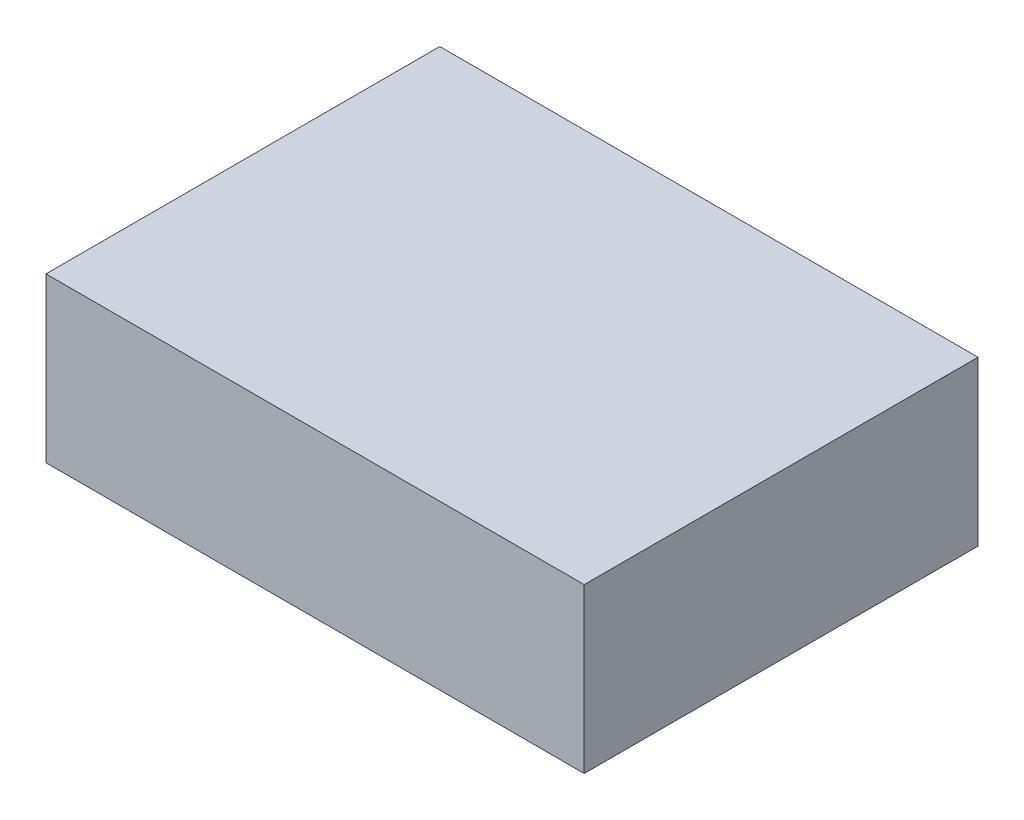
from build123d import *

# Parameters (mm, degrees)
SKETCH1_W           = 53.3
SKETCH1_H           = 39
BOSS_EXTRUDE1_DEPTH = 16.2


with BuildPart() as part:
    # Sketch1 → Boss-Extrude1 (new body)
    with BuildSketch(Plane(origin=(0, 0, 0), x_dir=(1, 0, 0), z_dir=(0, 1, 0))):
        Rectangle(SKETCH1_W, SKETCH1_H)
    extrude(amount=BOSS_EXTRUDE1_DEPTH)


solid = part.part
